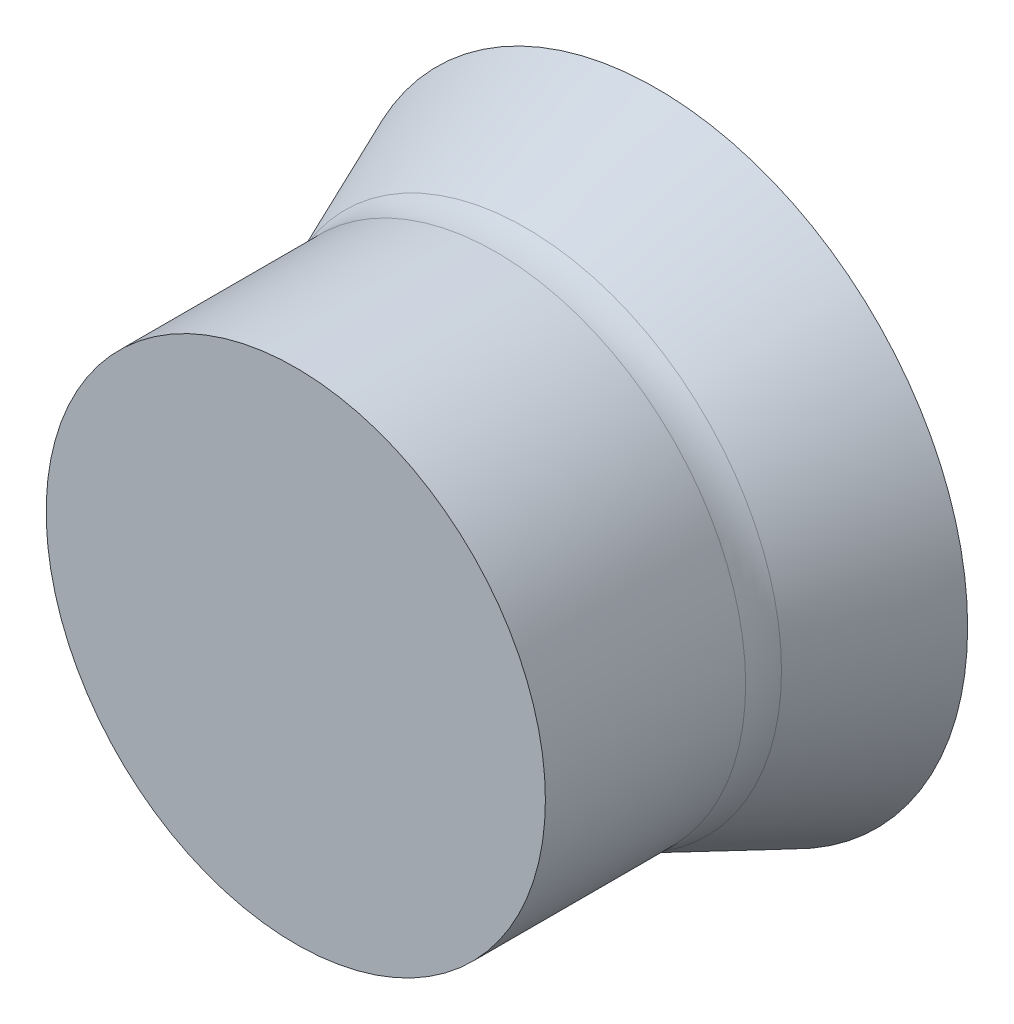
from build123d import *


with BuildPart() as part:
    # Sketch1 → Revolve1 (revolve)
    with BuildSketch(Plane(origin=(0, 0, 0), x_dir=(1, 0, 0), z_dir=(0, 1, 0))):
        with BuildLine():
            Line((0, -34.925), (34.925, -34.925))
            Line((34.925, -34.925), (34.925, 0))
            Line((34.925, 0), (37.465, 0))
            Line((37.465, 0), (46.67293073, 16.701920966))
            Line((46.67293073, 16.701920966), (38.37099626, -2.939984072))
            ThreePointArc((38.37099626, -2.939984072), (37.693777988, -5.129882303), (37.465, -7.410658373))
            Line((37.465, -7.410658373), (37.465, -37.465))
            Line((37.465, -37.465), (0, -37.465))
            Line((0, -37.465), (0, -34.925))
        make_face()
    revolve(axis=Axis((0, 0, 37.465), (0, 0, -1)))


solid = part.part
